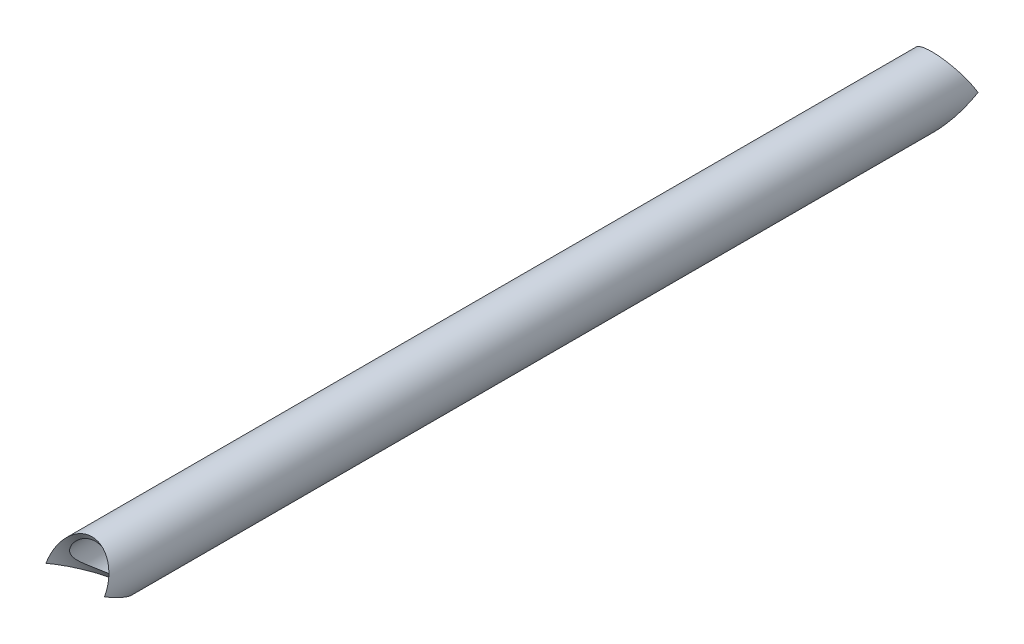
from build123d import *

# Parameters (mm, degrees)
EXTRUDE_START           = -140.979268616
EXTRUDE_1_OUTLINE_R     = 10.65
EXTRUDE_1_OUTLINE_R_2   = 8.65
EXTRUDE_1_DEPTH         = 140.979268616
EXTRUDE_START_2         = -159.425609917
EXTRUDE_1_2_OUTLINE_R   = 10.65
EXTRUDE_1_2_OUTLINE_R_2 = 8.65
EXTRUDE_1_2_DEPTH       = 18.446341301
EXTRUDE_START_3         = -13.834755825
EXTRUDE_1_3_DEPTH       = 98.834755825


with BuildPart() as part:
    # Бобышка-Вытянуть1: read off the stored shape, not the designer's step
    # Бобышка-Вытянуть1 outline → Бобышка-Вытянуть1 (new body)
    with BuildSketch(Plane.XY.offset(EXTRUDE_START)):
        with Locations((0, -5.325)):
            Circle(EXTRUDE_1_OUTLINE_R)
        with Locations((0, -5.325)):
            Circle(EXTRUDE_1_OUTLINE_R_2, mode=Mode.SUBTRACT)
    extrude(amount=EXTRUDE_1_DEPTH)

    # Extrude 1 2 outline → Extrude 1 2 (add)
    with BuildSketch(Plane.XY.offset(EXTRUDE_START_2)):
        with Locations((0, -5.325)):
            Circle(EXTRUDE_1_2_OUTLINE_R)
        with Locations((0, -5.325)):
            Circle(EXTRUDE_1_2_OUTLINE_R_2, mode=Mode.SUBTRACT)
    extrude(amount=EXTRUDE_1_2_DEPTH)

    # Extrude 1 3 outline → Extrude 1 3 (cut)
    with BuildSketch(Plane(origin=(0, 0, 0), x_dir=(1, 0, 0), z_dir=(0, 0.8660254037845098, -0.4999999999998769)).offset(EXTRUDE_START_3)):
        with BuildLine():
            ThreePointArc((-10.65, 140.729128115), (0, 130.079128115), (10.65, 140.729128115))
            Line((10.65, 140.729128115), (10.65, 148))
            Line((10.65, 148), (-10.65, 148))
            Line((-10.65, 148), (-10.65, 140.729128115))
        make_face()
    extrude(amount=EXTRUDE_1_3_DEPTH, mode=Mode.SUBTRACT)

    # Зеркальное отражение1: part across plane


with BuildPart() as part_1:
    add(part.part)
    add(part.part.mirror(Plane(origin=(0, -5.325, 0), x_dir=(1, 0, 0), z_dir=(0, 0, 1))))


solid = part_1.part
